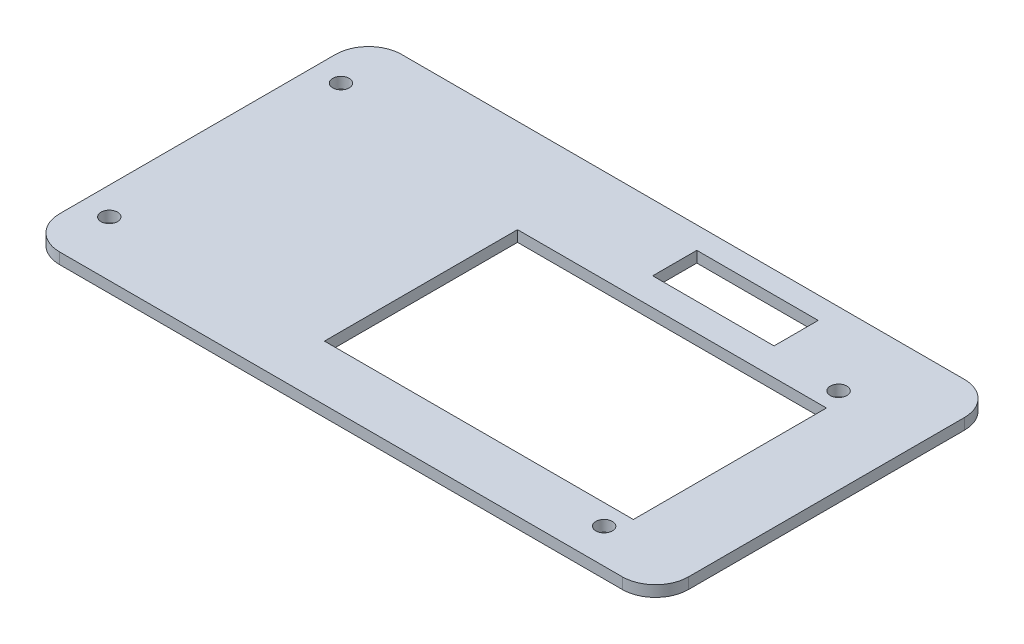
from build123d import *

# Parameters (mm, degrees)
SKETCH_1_W          = 56
SKETCH_1_H          = 35
EXTRUDE_1_DEPTH     = 2
SKETCH_3_R          = 1.5
SKETCH_3_W          = 22
SKETCH_3_H          = 8
CUT_EXTRUDE_1_DEPTH = 10
FILLET_1_R          = 6


with BuildPart() as part:
    # Эскиз1 → Бобышка-Вытянуть1 (new body)
    with BuildSketch(Plane(origin=(0, 0, 0), x_dir=(1, 0, 0), z_dir=(0, 1, 0))):
        Polygon((-82.5, -31), (-82.5, -21), (-82.5, 31), (-31.5, 31), (31.5, 31), (31.5, -31), align=None)
        with Locations((-10.5, -3.5)):
            Rectangle(SKETCH_1_W, SKETCH_1_H, mode=Mode.SUBTRACT)
    extrude(amount=EXTRUDE_1_DEPTH)

    # Эскиз3 → Вырез-Вытянуть1 (cut)
    with BuildSketch(Plane.XZ.offset(-2)):
        with Locations((15.9, 24.7)):
            Circle(SKETCH_3_R)
        with Locations((15.9, -17.8)):
            Circle(SKETCH_3_R)
        with Locations((-77.5, 21)):
            Circle(SKETCH_3_R)
        with Locations((-77.5, -21)):
            Circle(SKETCH_3_R)
        with Locations((-8, -23)):
            Rectangle(SKETCH_3_W, SKETCH_3_H)
    extrude(amount=CUT_EXTRUDE_1_DEPTH, mode=Mode.SUBTRACT)

    # Скругление1
    fillet_1_edges = [part.edges().sort_by_distance(p)[0] for p in [
        (31.5, 1, -31),
        (31.5, 1, 31),
        (-82.5, 1, -31),
        (-82.5, 1, 31),
    ]]
    fillet(fillet_1_edges, radius=FILLET_1_R)


solid = part.part
